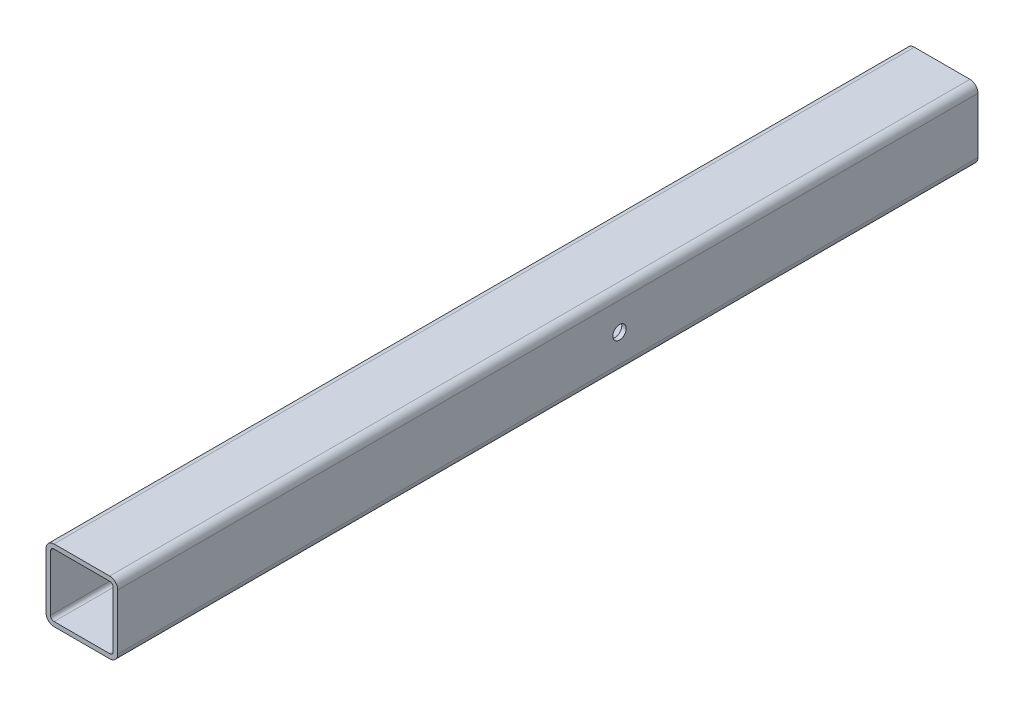
from build123d import *

# Parameters (mm, degrees)
BOSS_EXTRUDE1_DEPTH = 304.8
SKETCH3_R           = 4.7625
CUT_EXTRUDE2_DEPTH  = 76.2


with BuildPart() as part:
    # Sketch1 → Boss-Extrude1 (new, symmetric)
    with BuildSketch(Plane.XY):
        with BuildLine():
            Line((-19.685, 25.4), (19.685, 25.4))
            ThreePointArc((19.685, 25.4), (23.726115254, 23.726115254), (25.4, 19.685))
            Line((25.4, 19.685), (25.4, -19.685))
            ThreePointArc((25.4, -19.685), (23.726115254, -23.726115254), (19.685, -25.4))
            Line((19.685, -25.4), (-19.685, -25.4))
            ThreePointArc((-19.685, -25.4), (-23.726115254, -23.726115254), (-25.4, -19.685))
            Line((-25.4, -19.685), (-25.4, 19.685))
            ThreePointArc((-25.4, 19.685), (-23.726115254, 23.726115254), (-19.685, 25.4))
        make_face()
        with BuildLine():
            Line((-19.685, -22.225), (19.685, -22.225))
            ThreePointArc((19.685, -22.225), (21.481051224, -21.481051224), (22.225, -19.685))
            Line((22.225, -19.685), (22.225, 19.685))
            ThreePointArc((22.225, 19.685), (21.481051224, 21.481051224), (19.685, 22.225))
            Line((19.685, 22.225), (-19.685, 22.225))
            ThreePointArc((-19.685, 22.225), (-21.481051224, 21.481051224), (-22.225, 19.685))
            Line((-22.225, 19.685), (-22.225, -19.685))
            ThreePointArc((-22.225, -19.685), (-21.481051224, -21.481051224), (-19.685, -22.225))
        make_face(mode=Mode.SUBTRACT)
    extrude(amount=BOSS_EXTRUDE1_DEPTH, both=True)

    # Sketch3 → Cut-Extrude2 (cut)
    with BuildSketch(Plane(origin=(25.4, 0, 0), x_dir=(0, 0, -1), z_dir=(1, 0, 0))):
        with Locations((50.8, 0)):
            Circle(SKETCH3_R)
    extrude(amount=-CUT_EXTRUDE2_DEPTH, mode=Mode.SUBTRACT)


solid = part.part
